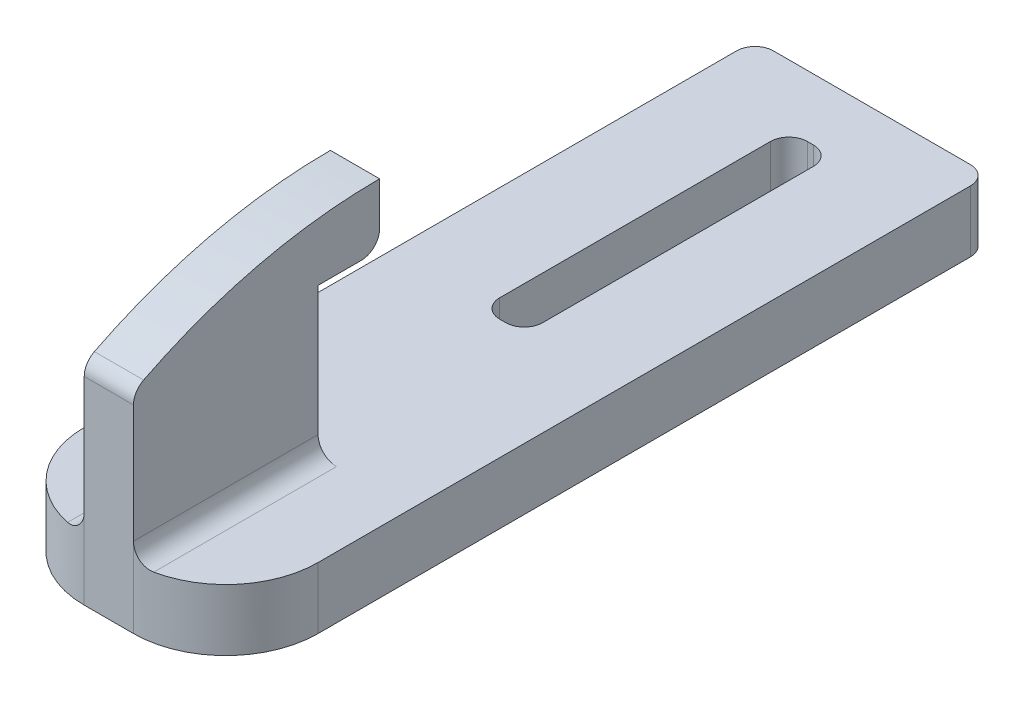
from build123d import *

# Parameters (mm, degrees)
SKETCH1_W           = 19
SKETCH1_H           = 62
SKETCH1_W_2         = 3.5
SKETCH1_H_2         = 25
BOSS_EXTRUDE1_DEPTH = 5
SKETCH4_W           = 4
SKETCH4_H           = 15
BOSS_EXTRUDE3_DEPTH = 12
BOSS_EXTRUDE4_DEPTH = 4
CUT_EXTRUDE1_DEPTH  = 68.037303048
FILLET1_R           = 1.5


with BuildPart() as part:
    # Sketch1 → Boss-Extrude1 (new body)
    with BuildSketch(Plane(origin=(0, 0, 0), x_dir=(1, 0, 0), z_dir=(0, 1, 0))):
        with Locations((-9.5, 31)):
            Rectangle(SKETCH1_W, SKETCH1_H)
        with Locations((-9.5, 44.5)):
            Rectangle(SKETCH1_W_2, SKETCH1_H_2, mode=Mode.SUBTRACT)
    extrude(amount=BOSS_EXTRUDE1_DEPTH)

    # Sketch4 → Boss-Extrude3 (add)
    with BuildSketch(Plane(origin=(0, 5, 0), x_dir=(1, 0, 0), z_dir=(0, 1, 0))):
        with Locations((-9.5, 7.5)):
            Rectangle(SKETCH4_W, SKETCH4_H)
    extrude(amount=BOSS_EXTRUDE3_DEPTH)

    # Sketch5 → Boss-Extrude4 (add)
    with BuildSketch(Plane(origin=(-7.5, 0, 0), x_dir=(0, 0, -1), z_dir=(1, 0, 0))):
        with BuildLine():
            Line((15, 17), (20, 17))
            Line((20, 17), (20, 22))
            ThreePointArc((20, 22), (9.692235936, 20.731056256), (0, 17))
            Line((0, 17), (15, 17))
        make_face()
    extrude(amount=-BOSS_EXTRUDE4_DEPTH)

    # Sketch6 → Cut-Extrude1 (cut, through all)
    with BuildSketch(Plane(origin=(0, 5, 0), x_dir=(1, 0, 0), z_dir=(0, 1, 0))):
        with BuildLine():
            Line((-19, 7.5), (-19, 0))
            Line((-19, 0), (-11.5, 0))
            ThreePointArc((-11.5, 0), (-16.803300859, 2.196699141), (-19, 7.5))
        make_face()
        with BuildLine():
            Line((0, 0), (-7.5, 0))
            ThreePointArc((-7.5, 0), (-2.196699141, 2.196699141), (0, 7.5))
            Line((0, 7.5), (0, 0))
        make_face()
    extrude(amount=-CUT_EXTRUDE1_DEPTH, mode=Mode.SUBTRACT)

    # Fillet1
    fillet1_edges = [part.edges().sort_by_distance(p)[0] for p in [
        (-9.5, 17, -20),
        (-9.5, 17, 0),
        (-11.25, 2.5, -57),
        (-7.75, 2.5, -57),
        (-7.75, 2.5, -32),
        (-11.25, 2.5, -32),
        (-19, 2.5, -62),
        (0, 2.5, -62),
        (-11.5, 5, -7.5),
        (-7.5, 5, -7.5),
    ]]
    fillet(fillet1_edges, radius=FILLET1_R)


solid = part.part
